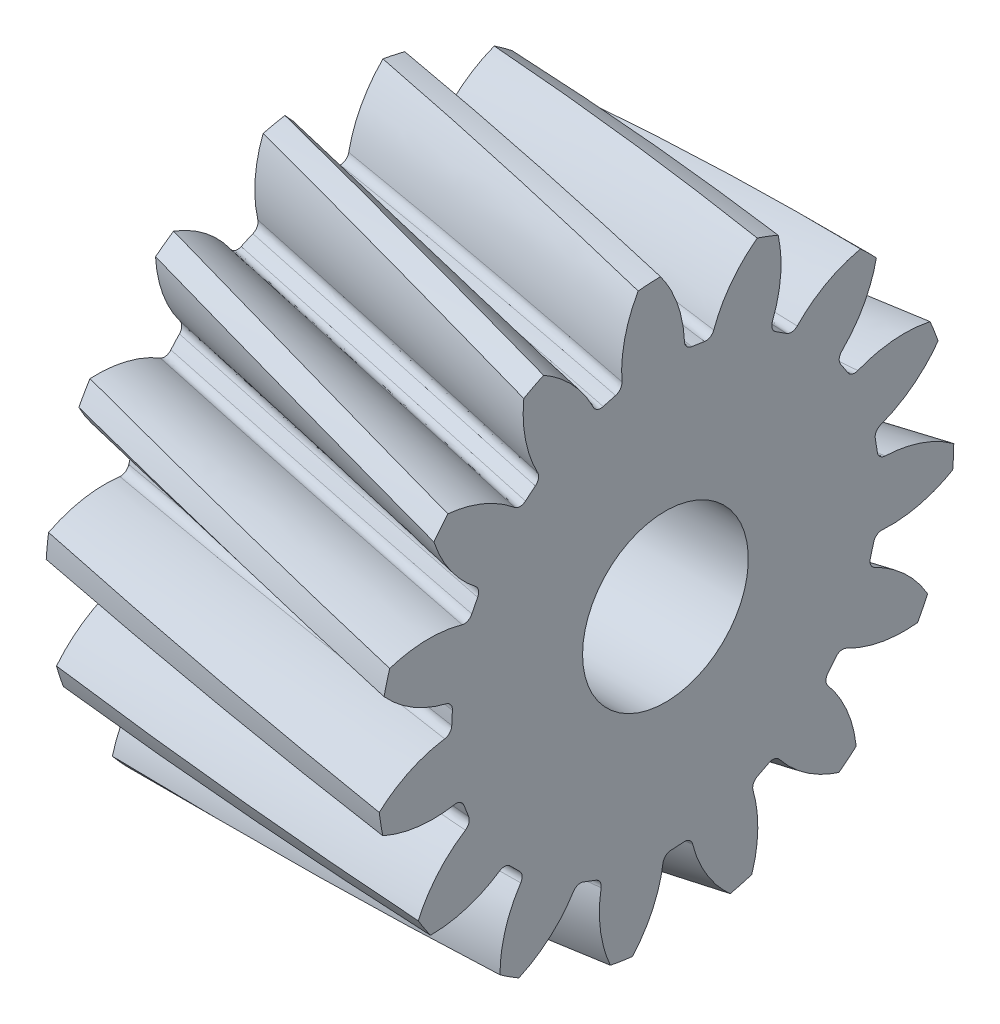
from build123d import *

# Parameters (mm, degrees)
BASPROSKE_W            = 10
BASPROSKE_H            = 8.697280808
TOOTHCUTRH_PITCH       = 236.70054641
TOOTHCUTRH_HEIGHT      = 10
TOOTHCUTRH_RADIUS      = 8.697280808
TOOTHCUTRH_START_ANGLE = -90
TEETHCUTSRH_COUNT      = 15
TEETHCUTSRH_ANGLE      = 336
BORSKE_R               = 2.5
BORE_DEPTH             = 62.5000025


with BuildPart() as part:
    # BasProSke → Base-Revolve (revolve)
    with BuildSketch(Plane(origin=(0, 0, 0), x_dir=(1, 0, 0), z_dir=(0, 1, 0)), mode=Mode.PRIVATE) as base_revolve_sk:
        with Locations((5, 4.348640404)):
            Rectangle(BASPROSKE_W, BASPROSKE_H)
    revolve(base_revolve_sk.sketch.rotate(Axis((-10, 0, 0), (1, 0, 0)), 180), axis=Axis((-10, 0, 0), (1, 0, 0)))

    # ToothCutRH: sweep along a helix
    with BuildLine() as toothcutrh_path:
        add(Helix(TOOTHCUTRH_PITCH, TOOTHCUTRH_HEIGHT, TOOTHCUTRH_RADIUS, center=(0, 0, 0), direction=(1, 0, 0), mode=Mode.PRIVATE).rotate(Axis((0, 0, 0), (1, 0, 0)), TOOTHCUTRH_START_ANGLE))
    # TooCutSkeRH → ToothCutRH (sweep, cut)
    with BuildSketch(Plane(origin=(0, 0, 0), x_dir=(0, 0, -1), z_dir=(1, 0, 0))):
        with BuildLine():
            ThreePointArc((0.192994022, 6.444391603), (0, 6.447280808), (-0.192994022, 6.444391603))
            ThreePointArc((-0.192994022, 6.444391603), (-0.356811976, 6.498886885), (-0.446681576, 6.646296222))
            ThreePointArc((-0.446681576, 6.646296222), (-0.899470141, 7.827895575), (-1.719478617, 8.791628221))
            ThreePointArc((-1.719478617, 8.791628221), (0, 8.958199233), (1.719478617, 8.791628221))
            ThreePointArc((1.719478617, 8.791628221), (0.899470141, 7.827895575), (0.446681576, 6.646296222))
            ThreePointArc((0.446681576, 6.646296222), (0.356811976, 6.498886885), (0.192994022, 6.444391603))
        make_face()
    toothcutrh = sweep(path=toothcutrh_path.line, is_frenet=True, mode=Mode.SUBTRACT)

    # TeethCutsRH: ToothCutRH ×15 about axis
    teethcutsrh_axis = Axis((-10, 0, 0), (1, 0, 0))
    for i in range(1, TEETHCUTSRH_COUNT):
        add(toothcutrh.rotate(teethcutsrh_axis, i * TEETHCUTSRH_ANGLE / (TEETHCUTSRH_COUNT - 1)), mode=Mode.SUBTRACT)

    # BorSke → Bore (cut, symmetric)
    with BuildSketch(Plane(origin=(0, 0, 0), x_dir=(0, 0, -1), z_dir=(1, 0, 0))):
        with Locations(Location((0, 0, 0), (0, 0, 180))):
            Circle(BORSKE_R)
    extrude(amount=BORE_DEPTH, both=True, mode=Mode.SUBTRACT)


solid = part.part
